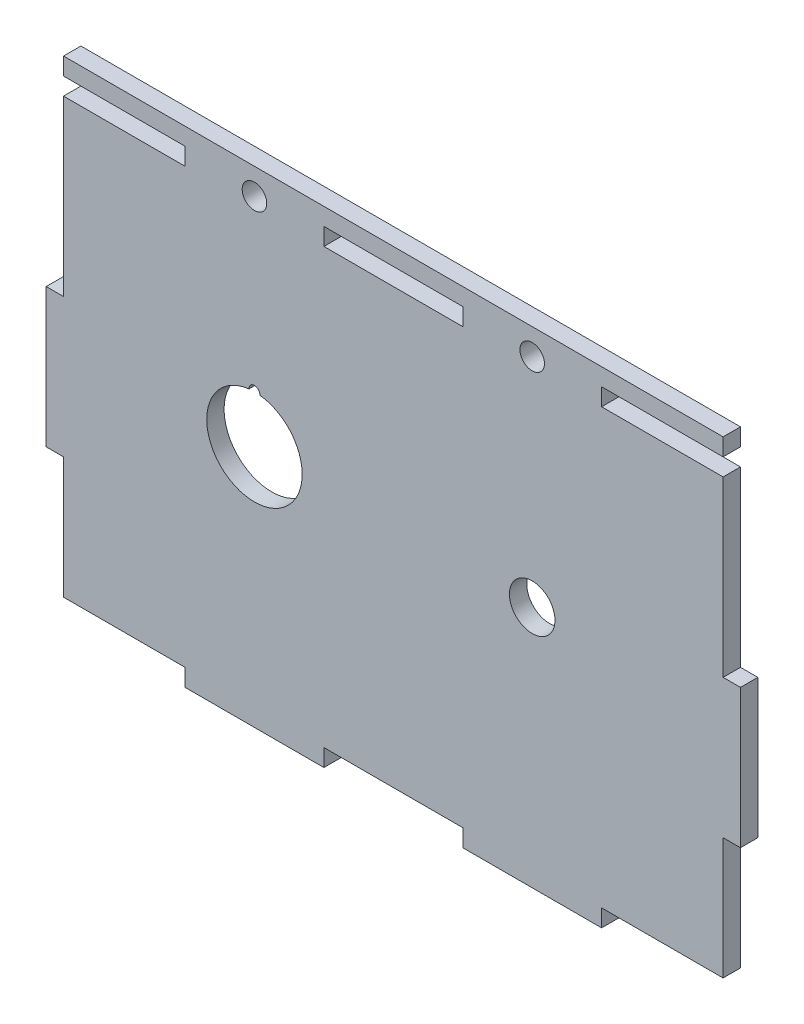
from build123d import *

# Parameters (mm, degrees)
SKETCH1_W                 = 127
SKETCH1_H                 = 88.9
BOSS_EXTRUDE1_DEPTH       = 3.175
SKETCH5_W                 = 3.175
SKETCH5_H                 = 25.4
CUT_EXTRUDE4_DEPTH        = 6.35
SKETCH6_W                 = 25.4
SKETCH6_H                 = 3.175
CUT_EXTRUDE5_DEPTH        = 6.35
LPATTERN5_COUNT           = 2
LPATTERN5_PITCH           = 50.8
LPATTERN5_COUNT_DIR2      = 2
LPATTERN5_PITCH_DIR2      = 123.825
LPATTERN6_COUNT           = 3
LPATTERN6_PITCH           = 50.8
LPATTERN6_COUNT_DIR2      = 2
LPATTERN6_PITCH_DIR2      = 82.55
F_8_CLEARANCE_HOLE1_D     = 4.4958
F_8_CLEARANCE_HOLE1_DEPTH = 10.16
F_8_CLEARANCE_HOLE1_TIP   = 1.350674586
SKETCH11_W                = 3.175
SKETCH11_H                = 12.7
CUT_EXTRUDE6_DEPTH        = 7.62
CUT_EXTRUDE7_DEPTH        = 7.62
SKETCH13_R                = 4.1671875
CUT_EXTRUDE8_DEPTH        = 7.62


with BuildPart() as part:
    # Sketch1 → Boss-Extrude1 (new body)
    with BuildSketch(Plane.XY):
        with Locations((63.5, 44.45)):
            Rectangle(SKETCH1_W, SKETCH1_H)
    extrude(amount=BOSS_EXTRUDE1_DEPTH)

    # Sketch5 → Cut-Extrude4 (cut)
    with BuildSketch(Plane.XY.offset(3.175)):
        with Locations((1.5875, 12.7)):
            Rectangle(SKETCH5_W, SKETCH5_H)
    cut_extrude4 = extrude(amount=-CUT_EXTRUDE4_DEPTH, mode=Mode.SUBTRACT)

    # Sketch6 → Cut-Extrude5 (cut)
    with BuildSketch(Plane.XY.offset(3.175)):
        with Locations((12.7, 1.5875)):
            Rectangle(SKETCH6_W, SKETCH6_H)
    cut_extrude5 = extrude(amount=-CUT_EXTRUDE5_DEPTH, mode=Mode.SUBTRACT)

    # LPattern5: Cut-Extrude4 2 × 2
    with Locations(*[(j * LPATTERN5_PITCH_DIR2, i * LPATTERN5_PITCH, 0) for i in range(LPATTERN5_COUNT) for j in range(LPATTERN5_COUNT_DIR2) if (i, j) != (0, 0)]):
        add(cut_extrude4, mode=Mode.SUBTRACT)

    # LPattern6: Cut-Extrude5 3 × 2
    with Locations(*[(i * LPATTERN6_PITCH, j * LPATTERN6_PITCH_DIR2, 0) for i in range(LPATTERN6_COUNT) for j in range(LPATTERN6_COUNT_DIR2) if (i, j) != (0, 0)]):
        add(cut_extrude5, mode=Mode.SUBTRACT)

    # #8 Clearance Hole1
    with Locations(Plane.XY.offset(3.175)):
        with Locations((38.1, 84.1375), (88.9, 84.1375)):
            Hole(F_8_CLEARANCE_HOLE1_D / 2, depth=F_8_CLEARANCE_HOLE1_DEPTH)
            with Locations((0, 0, -(F_8_CLEARANCE_HOLE1_DEPTH + F_8_CLEARANCE_HOLE1_TIP / 2))):  # 118° drill point
                Cone(0, F_8_CLEARANCE_HOLE1_D / 2, F_8_CLEARANCE_HOLE1_TIP, mode=Mode.SUBTRACT)

    # Sketch11 → Cut-Extrude6 (cut)
    with BuildSketch(Plane.XY.offset(3.175)):
        with Locations((1.5875, 82.55)):
            Rectangle(SKETCH11_W, SKETCH11_H)
        with Locations((125.4125, 82.55)):
            Rectangle(SKETCH11_W, SKETCH11_H)
    extrude(amount=-CUT_EXTRUDE6_DEPTH, mode=Mode.SUBTRACT)

    # Sketch12 → Cut-Extrude7 (cut)
    with BuildSketch(Plane.XY.offset(3.175)):
        with BuildLine():
            ThreePointArc((37.101641019, 53.123984431), (38.1, 35.71875), (39.098358981, 53.123984431))
            ThreePointArc((39.098358981, 53.123984431), (38.1, 54.18125), (37.101641019, 53.123984431))
        make_face()
    extrude(amount=-CUT_EXTRUDE7_DEPTH, mode=Mode.SUBTRACT)

    # Sketch13 → Cut-Extrude8 (cut)
    with BuildSketch(Plane.XY.offset(3.175)):
        with Locations((88.9, 44.45)):
            Circle(SKETCH13_R)
    extrude(amount=-CUT_EXTRUDE8_DEPTH, mode=Mode.SUBTRACT)


solid = part.part
